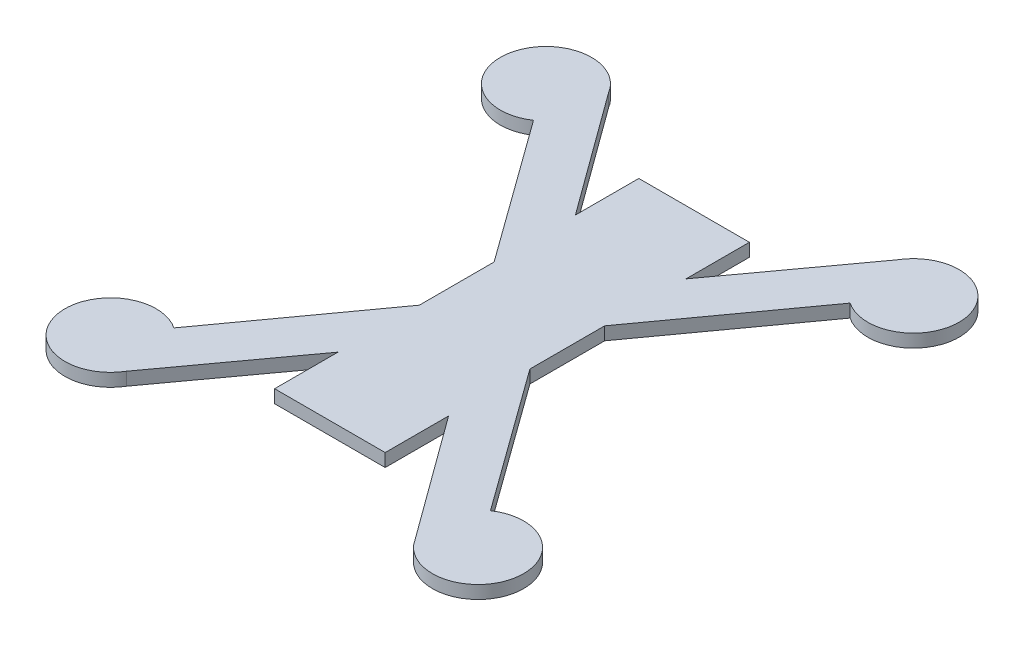
from build123d import *

# Parameters (mm, degrees)
BOSS_EXTRUDE4_DEPTH = 4


with BuildPart() as part:
    # Frame Sketch → Boss-Extrude4 (new body)
    with BuildSketch(Plane(origin=(0, 0, 0), x_dir=(1, 0, 0), z_dir=(0, 1, 0))):
        with BuildLine():
            Line((-48.674660208, 55.289940373), (-17, 11.5))
            Line((-17, 11.5), (-17, -11.5))
            Line((-17, -11.5), (-48.674660208, -55.289940373))
            ThreePointArc((-48.674660208, -55.289940373), (-70.19364015, -70.05807875), (-44.404496623, -74.068625474))
            Line((-44.404496623, -74.068625474), (-17, -36.5))
            Line((-17, -36.5), (-17, -56))
            Line((-17, -56), (17, -56))
            Line((17, -56), (17, -36.5))
            Line((17, -36.5), (46.024838487, -76.289940373))
            ThreePointArc((46.024838487, -76.289940373), (70.432680647, -68.702590503), (48.674660208, -55.289940373))
            Line((48.674660208, -55.289940373), (17, -11.5))
            Line((17, -11.5), (17, 11.5))
            Line((17, 11.5), (48.674660208, 55.289940373))
            ThreePointArc((48.674660208, 55.289940373), (70.19364015, 70.05807875), (44.404496623, 74.068625474))
            Line((44.404496623, 74.068625474), (17, 36.5))
            Line((17, 36.5), (17, 56))
            Line((17, 56), (-17, 56))
            Line((-17, 56), (-17, 36.5))
            Line((-17, 36.5), (-44.404496623, 74.068625474))
            ThreePointArc((-44.404496623, 74.068625474), (-70.19364015, 70.05807875), (-48.674660208, 55.289940373))
        make_face()
    extrude(amount=BOSS_EXTRUDE4_DEPTH)


solid = part.part
